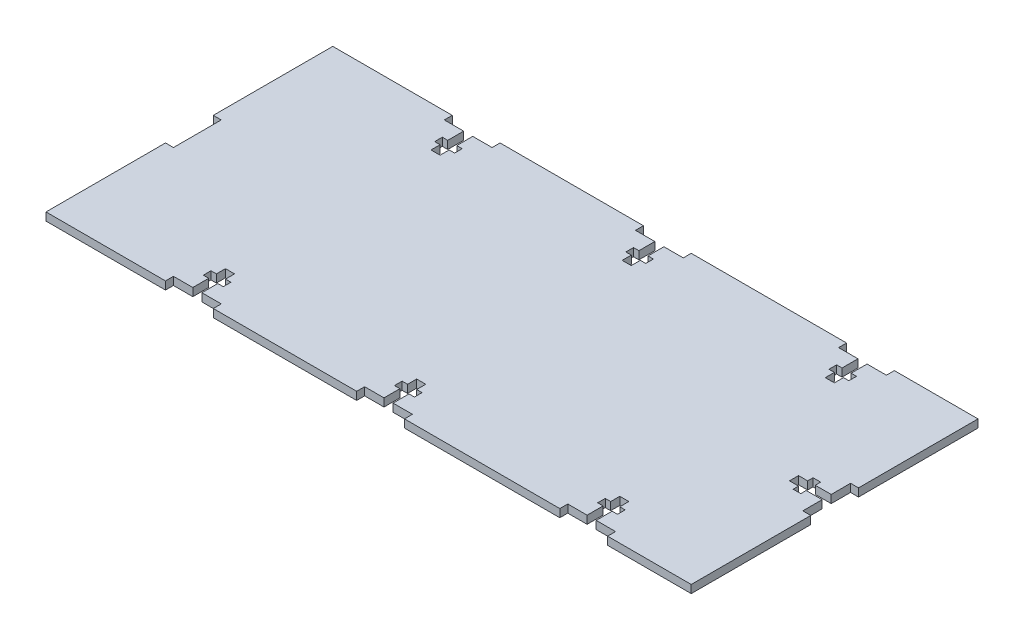
from build123d import *

# Parameters (mm, degrees)
BOSS_EXTRUDE1_DEPTH = 2.54


with BuildPart() as part:
    # Sketch2 → Boss-Extrude1 (new body)
    with BuildSketch(Plane(origin=(0, 0, 0), x_dir=(1, 0, 0), z_dir=(0, 1, 0))):
        Polygon((-102.87, -45.72), (-64.77, -45.72), (-64.77, -43.18), (-58.5978, -43.18), (-58.5978, -38.1), (-60.325, -38.1), (-60.325, -35.66795), (-58.5978, -35.66795), (-58.5978, -32.766), (-55.7022, -32.766), (-55.7022, -35.66795), (-53.975, -35.66795), (-53.975, -38.1), (-55.7022, -38.1), (-55.7022, -43.18), (-49.53, -43.18), (-49.53, -45.72), (-3.81, -45.72), (-3.81, -43.18), (2.3622, -43.18), (2.3622, -38.1), (0.635, -38.1), (0.635, -35.66795), (2.3622, -35.66795), (2.3622, -32.766), (5.2578, -32.766), (5.2578, -35.66795), (6.985, -35.66795), (6.985, -38.1), (5.2578, -38.1), (5.2578, -43.18), (11.43, -43.18), (11.43, -45.72), (60.96, -45.72), (60.96, -43.18), (67.1322, -43.18), (67.1322, -38.1), (65.405, -38.1), (65.405, -35.66795), (67.1322, -35.66795), (67.1322, -32.766), (70.0278, -32.766), (70.0278, -35.66795), (71.755, -35.66795), (71.755, -38.1), (70.0278, -38.1), (70.0278, -43.18), (76.2, -43.18), (76.2, -45.72), (102.87, -45.72), (102.87, -7.62), (100.33, -7.62), (100.33, -1.4478), (95.25, -1.4478), (95.25, -3.175), (92.81795, -3.175), (92.81795, -1.4478), (89.916, -1.4478), (89.916, 1.4478), (92.81795, 1.4478), (92.81795, 3.175), (95.25, 3.175), (95.25, 1.4478), (100.33, 1.4478), (100.33, 7.62), (102.87, 7.62), (102.87, 45.72), (76.2, 45.72), (76.2, 43.18), (70.0278, 43.18), (70.0278, 38.1), (71.755, 38.1), (71.755, 35.66795), (70.0278, 35.66795), (70.0278, 32.766), (67.1322, 32.766), (67.1322, 35.66795), (65.405, 35.66795), (65.405, 38.1), (67.1322, 38.1), (67.1322, 43.18), (60.96, 43.18), (60.96, 45.72), (11.43, 45.72), (11.43, 43.18), (5.2578, 43.18), (5.2578, 38.1), (6.985, 38.1), (6.985, 35.66795), (5.2578, 35.66795), (5.2578, 32.766), (2.3622, 32.766), (2.3622, 35.66795), (0.635, 35.66795), (0.635, 38.1), (2.3622, 38.1), (2.3622, 43.18), (-3.81, 43.18), (-3.81, 45.72), (-49.53, 45.72), (-49.53, 43.18), (-55.7022, 43.18), (-55.7022, 38.1), (-53.975, 38.1), (-53.975, 35.66795), (-55.7022, 35.66795), (-55.7022, 32.766), (-58.5978, 32.766), (-58.5978, 35.66795), (-60.325, 35.66795), (-60.325, 38.1), (-58.5978, 38.1), (-58.5978, 43.18), (-64.77, 43.18), (-64.77, 45.72), (-102.87, 45.72), (-102.87, 7.62), (-100.33, 7.62), (-100.33, -7.62), (-102.87, -7.62), align=None)
    extrude(amount=-BOSS_EXTRUDE1_DEPTH)


solid = part.part
